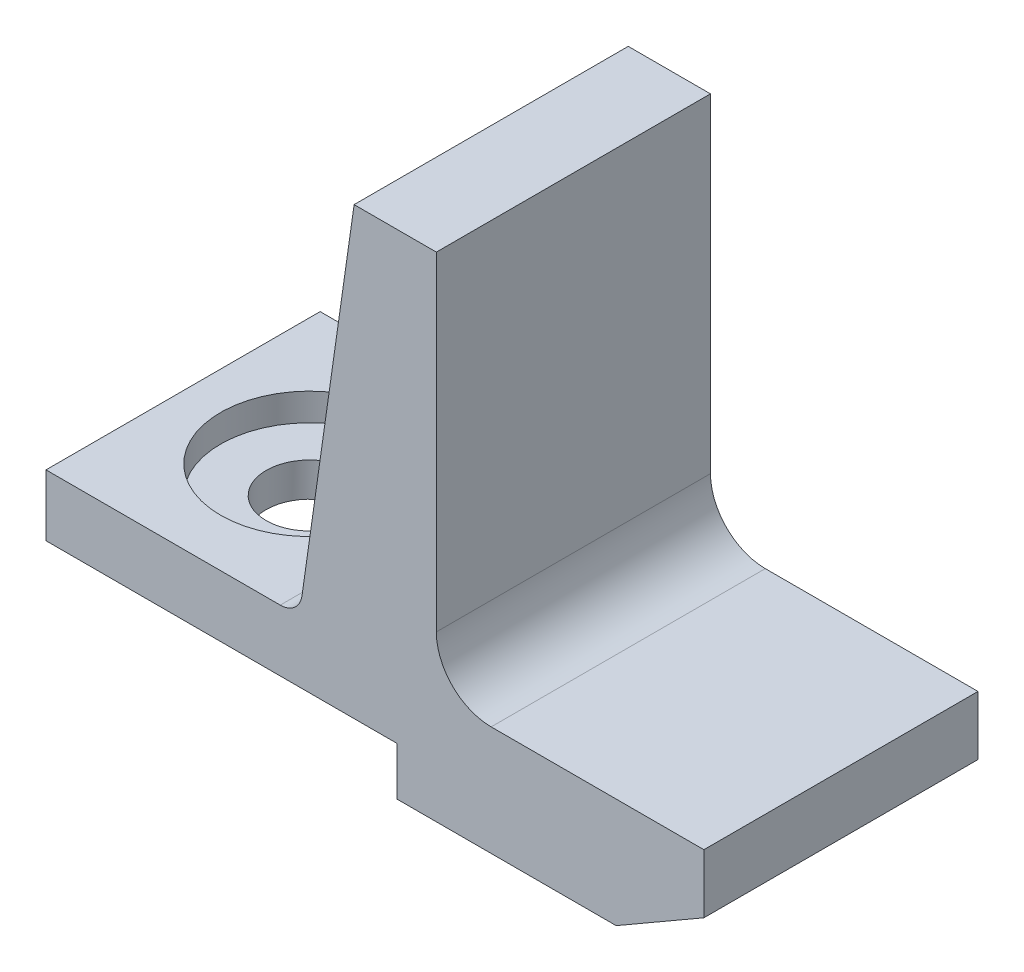
from build123d import *

# Parameters (mm, degrees)
BOSS_EXTRUDE1_DEPTH                                  = 31.75
CBORE_FOR_3_8_BINDING_HEAD_MACHINE_SCREW_D           = 10.0838
CBORE_FOR_3_8_BINDING_HEAD_MACHINE_SCREW_CBORE_D     = 20.6375
CBORE_FOR_3_8_BINDING_HEAD_MACHINE_SCREW_CBORE_DEPTH = 3.175
CHAMFER1_SIZE                                        = 10.16
CHAMFER1_SIZE2                                       = 5.865878735
FILLET1_R                                            = 2.54
FILLET2_R                                            = 6.35


with BuildPart() as part:
    # Sketch1 → Boss-Extrude1 (new body)
    with BuildSketch(Plane.XY):
        Polygon((0, 0), (30.988, 0), (30.988, -12.7), (-4.572, -12.7), (-4.572, -7.112), (-45.212, -7.112), (-45.212, 0), (-15.875, 0), (-9.525, 44.45), (0, 44.45), align=None)
    extrude(amount=BOSS_EXTRUDE1_DEPTH)

    # CBORE for 3/8 Binding Head Machine Screw1 (through all)
    with Locations(Plane(origin=(0, 0, 0), x_dir=(1, 0, 0), z_dir=(0, 1, 0))):
        with Locations((-30.5435, -15.875)):
            CounterBoreHole(CBORE_FOR_3_8_BINDING_HEAD_MACHINE_SCREW_D / 2, CBORE_FOR_3_8_BINDING_HEAD_MACHINE_SCREW_CBORE_D / 2, CBORE_FOR_3_8_BINDING_HEAD_MACHINE_SCREW_CBORE_DEPTH)

    # Chamfer1
    chamfer1_edges = [part.edges().sort_by_distance(p)[0] for p in [
        (30.988, -12.7, 15.875),
    ]]
    chamfer1_side = [part.faces().sort_by_distance(p)[0] for p in [
        (13.208, -12.7, 15.875),
    ]]
    chamfer(chamfer1_edges, length=CHAMFER1_SIZE, length2=CHAMFER1_SIZE2, reference=chamfer1_side[0])

    # Fillet1
    fillet1_edges = [part.edges().sort_by_distance(p)[0] for p in [
        (-15.875, 0, 15.875),
    ]]
    fillet(fillet1_edges, radius=FILLET1_R)

    # Fillet2
    fillet2_edges = [part.edges().sort_by_distance(p)[0] for p in [
        (0, 0, 15.875),
    ]]
    fillet(fillet2_edges, radius=FILLET2_R)


solid = part.part
